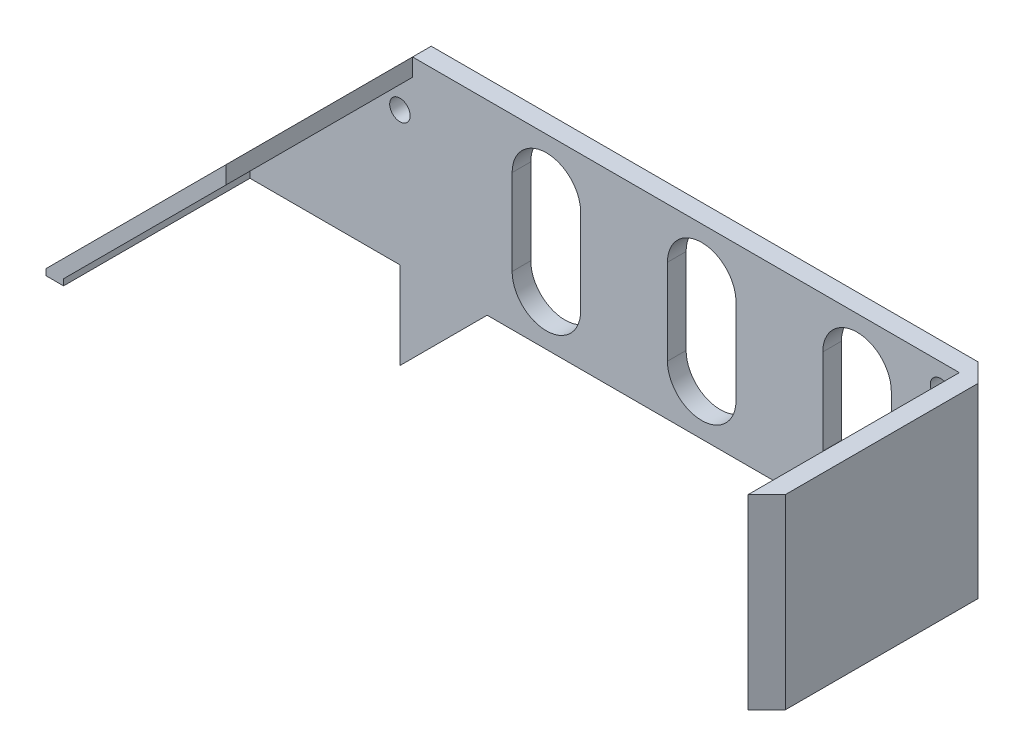
from build123d import *

# Parameters (mm, degrees)
SKETCH_1_W           = 100
SKETCH_1_H           = 30
EXTRUDE_1_DEPTH      = 3
CUT_EXTRUDE_1_REACH  = 106.446
EXTRUDE_3_DEPTH      = 3
CUT_EXTRUDE_2_REACH  = 106.446
SKETCH_5_R           = 1.65
SKETCH_5_R_2         = 1.683787266
EXTRUDE_4_DEPTH      = 34
EXTRUDE_4_DEPTH_BACK = 3
SKETCH_6_W           = 3
SKETCH_6_H           = 30
EXTRUDE_5_DEPTH      = 30
CHAMFER_1_SIZE       = 3
CHAMFER_2_SIZE       = 3
EXTRUDE_6_DEPTH      = 3
CUT_EXTRUDE_3_DEPTH  = 114.481275989


with BuildPart() as part:
    # 草图1 → 凸台-拉伸1 (new body)
    with BuildSketch(Plane.XY):
        with Locations((50, 15)):
            Rectangle(SKETCH_1_W, SKETCH_1_H)
    extrude(amount=EXTRUDE_1_DEPTH)

    # 草图2 → 切除-拉伸1 (cut, up to next)
    with BuildSketch(Plane.XY.offset(3), mode=Mode.PRIVATE) as cut_extrude_1_sk1:
        Polygon((0, 18), (12, 30), (0, 30), align=None)
    cut_extrude_1_tool1 = extrude(cut_extrude_1_sk1.sketch, amount=-CUT_EXTRUDE_1_REACH, mode=Mode.PRIVATE) & part.part
    add(cut_extrude_1_tool1.solids().sort_by_distance((4, 26, 3))[0], mode=Mode.SUBTRACT)

    # 草图4 → 凸台-拉伸3 (add)
    with BuildSketch(Plane(origin=(0, 0, 0), x_dir=(-1, 0, 0), z_dir=(0, 0, -1))):
        Polygon((0, 0), (17, 0), (17, 1), (0, 18), align=None)
    extrude(amount=-EXTRUDE_3_DEPTH)

    # 草图5 → 切除-拉伸2 (cut, up to next)
    with BuildSketch(Plane.XY.offset(3), mode=Mode.PRIVATE) as cut_extrude_2_sk1:
        with Locations((9.963410089, 21.593670707)):
            Circle(SKETCH_5_R)
    cut_extrude_2_tool1 = extrude(cut_extrude_2_sk1.sketch, amount=-CUT_EXTRUDE_2_REACH, mode=Mode.PRIVATE) & part.part
    # 草图5 → 切除-拉伸2 (cut, up to next)
    with BuildSketch(Plane.XY.offset(3), mode=Mode.PRIVATE) as cut_extrude_2_sk2:
        with Locations((97, 26)):
            Circle(SKETCH_5_R_2)
    cut_extrude_2_tool2 = extrude(cut_extrude_2_sk2.sketch, amount=-CUT_EXTRUDE_2_REACH, mode=Mode.PRIVATE) & part.part
    # 草图5 → 切除-拉伸2 (cut, up to next)
    with BuildSketch(Plane.XY.offset(3), mode=Mode.PRIVATE) as cut_extrude_2_sk3:
        with Locations((97, 4)):
            Circle(SKETCH_5_R)
    cut_extrude_2_tool3 = extrude(cut_extrude_2_sk3.sketch, amount=-CUT_EXTRUDE_2_REACH, mode=Mode.PRIVATE) & part.part
    add(cut_extrude_2_tool1.solids().sort_by_distance((9.96341, 21.593671, 3))[0], mode=Mode.SUBTRACT)
    add(cut_extrude_2_tool2.solids().sort_by_distance((97, 26, 3))[0], mode=Mode.SUBTRACT)
    add(cut_extrude_2_tool3.solids().sort_by_distance((97, 4, 3))[0], mode=Mode.SUBTRACT)

    # 草图6 → 凸台-拉伸4 (add, two sides: drawn at the far end of the back side and taken through both)
    with BuildSketch(Plane.XY.offset(3).offset(-EXTRUDE_4_DEPTH_BACK)):
        with Locations((101.5, 15)):
            Rectangle(SKETCH_6_W, SKETCH_6_H)
    extrude(amount=EXTRUDE_4_DEPTH + EXTRUDE_4_DEPTH_BACK)

    # 草图7 → 凸台-拉伸5 (add)
    with BuildSketch(Plane.XY.offset(3)):
        Polygon((-17, 1), (12, 30), (12, 27.171572875), (-14.171572875, 1), (-14.171572875, 0), (-17, 0), align=None)
    extrude(amount=EXTRUDE_5_DEPTH)

    # 倒角1
    chamfer_1_edges = [part.edges().sort_by_distance(p)[0] for p in [
        (103, 15, 0),
    ]]
    chamfer(chamfer_1_edges, length=CHAMFER_1_SIZE)

    # 倒角2
    chamfer_2_edges = [part.edges().sort_by_distance(p)[0] for p in [
        (103, 15, 37),
    ]]
    chamfer(chamfer_2_edges, length=CHAMFER_2_SIZE - 0.0001)  # a hair under: the kernel refuses the full size

    # 草图3 → 凸台-拉伸6 (add)
    with BuildSketch(Plane(origin=(0, 0, 0), x_dir=(-1, 0, 0), z_dir=(0, 0, -1))):
        Polygon((-24, 0), (-10, -14), (-10, 0), align=None)
    extrude(amount=-EXTRUDE_6_DEPTH)

    # 草图8 → 切除-拉伸3 (cut, through all)
    with BuildSketch(Plane(origin=(0, 0, 0), x_dir=(-1, 0, 0), z_dir=(0, 0, -1))):
        with BuildLine():
            Line((-78.021683781, 21.894650921), (-78.021683781, 8.105349079))
            ThreePointArc((-78.021683781, 8.105349079), (-83.534405897, 2.592626964), (-89.047128012, 8.105349079))
            Line((-89.047128012, 8.105349079), (-89.047128012, 21.894650921))
            ThreePointArc((-89.047128012, 21.894650921), (-83.534405897, 27.407373036), (-78.021683781, 21.894650921))
        make_face()
        with BuildLine():
            Line((-53.021683781, 21.894650921), (-53.021683781, 8.105349079))
            ThreePointArc((-53.021683781, 8.105349079), (-58.534405897, 2.592626964), (-64.047128012, 8.105349079))
            Line((-64.047128012, 8.105349079), (-64.047128012, 21.894650921))
            ThreePointArc((-64.047128012, 21.894650921), (-58.534405897, 27.407373036), (-53.021683781, 21.894650921))
        make_face()
        with BuildLine():
            Line((-28.021683781, 21.894650921), (-28.021683781, 8.105349079))
            ThreePointArc((-28.021683781, 8.105349079), (-33.534405897, 2.592626964), (-39.047128012, 8.105349079))
            Line((-39.047128012, 8.105349079), (-39.047128012, 21.894650921))
            ThreePointArc((-39.047128012, 21.894650921), (-33.534405897, 27.407373036), (-28.021683781, 21.894650921))
        make_face()
    extrude(amount=-CUT_EXTRUDE_3_DEPTH, mode=Mode.SUBTRACT)


solid = part.part
